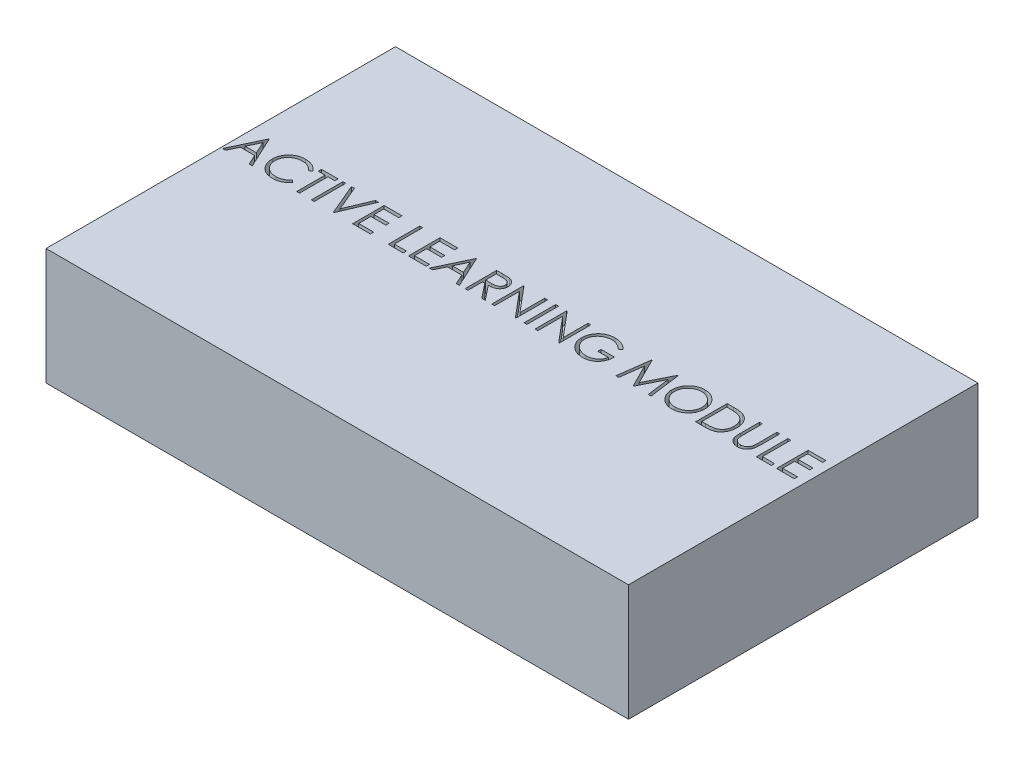
from build123d import *

# Parameters (mm, degrees)
SKETCH1_W           = 127
SKETCH1_H           = 76.2
BOSS_EXTRUDE1_DEPTH = 12.7
WRAP1_START         = -2.54
WRAP1_OUTLINE_W     = 0.617361111
WRAP1_OUTLINE_H     = 6.879166667
WRAP1_DEPTH         = 2.54


# Read off the part's stored shape, not the designer's step: Wrap1
with BuildPart() as part:
    # Sketch1 → Boss-Extrude1 (new, symmetric)
    with BuildSketch(Plane(origin=(0, 0, 0), x_dir=(1, 0, 0), z_dir=(0, 1, 0))):
        Rectangle(SKETCH1_W, SKETCH1_H)
    extrude(amount=BOSS_EXTRUDE1_DEPTH, both=True)

    # Wrap1 outline → Wrap1 (cut)
    # profile 1 of 20: a face of its own
    with BuildSketch(Plane(origin=(0, 12.7, 0), x_dir=(1, 0, 0), z_dir=(0, 1, 0)).offset(WRAP1_START)):
        with BuildLine():
            add(Edge.make_bspline(
                [(47.713194444, 2.757454427), (47.71310257, 2.699117648), (47.712928223, 2.588413556), (47.714092795, 2.43084467), (47.717354244, 2.290760348), (47.719410446, 2.167620616), (47.723984765, 2.061990526), (47.727715331, 1.973297802), (47.732512187, 1.901962411), (47.738277159, 1.860331805), (47.740755208, 1.842437066)],
                knots=[0, 0, 0, 0, 0.191078592, 0.362604556, 0.51609875, 0.650038026, 0.765976721, 0.862374026, 0.940842058, 1, 1, 1, 1], degree=3))
            Line((47.713194444, 2.757454427), (47.713194444, 6.879166667))
            Line((47.713194444, 6.879166667), (47.095833333, 6.879166667))
            Line((47.095833333, 6.879166667), (47.095833333, 2.72438151))
            add(Edge.make_bspline(
                [(47.218478733, 1.27468533), (47.208303152, 1.311307211), (47.186232089, 1.390740888), (47.162596653, 1.522204688), (47.142727494, 1.673575675), (47.124044546, 1.84486421), (47.113020272, 2.036203055), (47.103355164, 2.247509269), (47.095765244, 2.479038358), (47.095810002, 2.640314555), (47.095833333, 2.72438151)],
                knots=[0, 0, 0, 0, 0.078129865, 0.169465417, 0.274335291, 0.392110163, 0.52368733, 0.668365421, 0.827131902, 1, 1, 1, 1], degree=3))
            add(Edge.make_bspline(
                [(49.368218316, -0.176388889), (49.302042496, -0.174846451), (49.172205775, -0.171820195), (48.980890122, -0.154479289), (48.797483291, -0.121816231), (48.620048204, -0.080226865), (48.45100055, -0.022866925), (48.288075459, 0.044152128), (48.134063337, 0.126460886), (47.98646565, 0.21803909), (47.849226754, 0.321078469), (47.723244834, 0.43338612), (47.608311903, 0.553162981), (47.506365215, 0.681705843), (47.415715715, 0.818014971), (47.337626926, 0.962475977), (47.270578157, 1.11503293), (47.235972869, 1.22107666), (47.218478733, 1.27468533)],
                knots=[0, 0, 0, 0, 0.071174504, 0.139644122, 0.206317224, 0.27137324, 0.335418084, 0.398076345, 0.460607915, 0.522969511, 0.584715724, 0.64489494, 0.704290561, 0.76299819, 0.821087431, 0.880103891, 0.939388488, 1, 1, 1, 1], degree=3))
            add(Edge.make_bspline(
                [(51.505555556, 2.72438151), (51.505056088, 2.649500054), (51.504081347, 2.503364338), (51.495628666, 2.289223036), (51.482151396, 2.086085212), (51.46310969, 1.89392356), (51.437878866, 1.713425706), (51.40982126, 1.543009549), (51.37408982, 1.383898369), (51.332356076, 1.234851558), (51.284646995, 1.09297265), (51.222850167, 0.958320599), (51.153224155, 0.82680194), (51.070645356, 0.700405883), (50.977852507, 0.578572789), (50.872794501, 0.462041523), (50.758945942, 0.348949898), (50.634414236, 0.24219886), (50.501252192, 0.144301091), (50.359855918, 0.058217615), (50.211311577, -0.014551424), (50.056005296, -0.074451128), (49.893870801, -0.119489227), (49.724904003, -0.153050039), (49.548720302, -0.172119674), (49.428895722, -0.174953753), (49.368218316, -0.176388889)],
                knots=[0, 0, 0, 0, 0.054858035, 0.107058792, 0.156978355, 0.203992277, 0.248491536, 0.290483314, 0.330489004, 0.367885926, 0.403858131, 0.440009343, 0.476295011, 0.512792295, 0.550484825, 0.588381116, 0.627645327, 0.667979464, 0.708432758, 0.748602302, 0.789087777, 0.829461205, 0.870371045, 0.912214227, 0.955546575, 1, 1, 1, 1], degree=3))
            Line((51.505555556, 2.72438151), (51.505555556, 6.879166667))
            Line((51.505555556, 6.879166667), (50.888194444, 6.879166667))
            Line((50.888194444, 6.879166667), (50.888194444, 2.757454427))
            add(Edge.make_bspline(
                [(50.817914497, 1.689474826), (50.823811171, 1.713745655), (50.836951339, 1.767830843), (50.849229757, 1.859267332), (50.862018178, 1.96715107), (50.870891458, 2.092257193), (50.879541952, 2.234166485), (50.884717194, 2.393618213), (50.887109243, 2.570033382), (50.887822083, 2.693145232), (50.888194444, 2.757454427)],
                knots=[0, 0, 0, 0, 0.069835104, 0.155620755, 0.257801557, 0.373811234, 0.506402493, 0.655564458, 0.820079282, 1, 1, 1, 1], degree=3))
            add(Edge.make_bspline(
                [(49.333767361, 0.529166667), (49.389889058, 0.531277294), (49.501808308, 0.535486358), (49.668100233, 0.561551385), (49.830055684, 0.608527377), (49.988474402, 0.669142188), (50.136968063, 0.749230608), (50.275619518, 0.841747223), (50.399373632, 0.950262885), (50.512305959, 1.070354157), (50.610648434, 1.205853693), (50.69589338, 1.353811081), (50.765718749, 1.516452952), (50.800200129, 1.630754084), (50.817914497, 1.689474826)],
                knots=[0, 0, 0, 0, 0.082890648, 0.165302541, 0.247761876, 0.331527711, 0.415279813, 0.49636623, 0.577151348, 0.65778254, 0.739321642, 0.823793082, 0.909475953, 1, 1, 1, 1], degree=3))
            add(Edge.make_bspline(
                [(47.740755208, 1.842437066), (47.75093138, 1.777877535), (47.770710333, 1.652396171), (47.821117678, 1.473718107), (47.891516124, 1.312683777), (47.974936914, 1.164268132), (48.08487113, 1.03260214), (48.216564983, 0.911309355), (48.376117954, 0.805229058), (48.553523026, 0.708231213), (48.744734844, 0.630270438), (48.940125321, 0.571319194), (49.136757414, 0.535392452), (49.268397472, 0.531232445), (49.333767361, 0.529166667)],
                knots=[0, 0, 0, 0, 0.086315004, 0.167766466, 0.244432684, 0.318134662, 0.391884107, 0.47006805, 0.553904179, 0.644339498, 0.736874663, 0.826168364, 0.913678595, 1, 1, 1, 1], degree=3))
        make_face()
    # profile 2 of 20: a face of its own
    with BuildSketch(Plane(origin=(0, 12.7, 0), x_dir=(1, 0, 0), z_dir=(0, 1, 0)).offset(WRAP1_START)):
        with BuildLine():
            add(Edge.make_bspline(
                [(41.429340278, 6.879166667), (41.550156111, 6.878296806), (41.783571671, 6.876616239), (42.12087185, 6.865960624), (42.432957555, 6.847110792), (42.718802377, 6.819654021), (42.979191044, 6.785940142), (43.213394452, 6.743681609), (43.422623604, 6.693781764), (43.551302231, 6.651238147), (43.612152778, 6.631119792)],
                knots=[0, 0, 0, 0, 0.164289216, 0.317405911, 0.458843612, 0.589366542, 0.707831319, 0.815770031, 0.912879903, 1, 1, 1, 1], degree=3))
            Line((41.429340278, 6.879166667), (40.040277778, 6.879166667))
            Line((40.040277778, 6.879166667), (40.040277778, 0))
            Line((40.040277778, 0), (42.172102865, 0))
            add(Edge.make_bspline(
                [(45.684722222, 3.352766927), (45.683486002, 3.267737993), (45.6810499, 3.100179597), (45.659175494, 2.853235408), (45.627381323, 2.613617186), (45.578157548, 2.382465983), (45.518402132, 2.157756593), (45.44181902, 1.941883932), (45.354089015, 1.732867706), (45.251786218, 1.533534072), (45.139476186, 1.344684492), (45.01894976, 1.166660448), (44.890335493, 1.002002244), (44.752406958, 0.850211246), (44.606946553, 0.711516281), (44.453001946, 0.584758761), (44.290175902, 0.472418913), (44.119197708, 0.370082252), (43.935079506, 0.280809624), (43.734333893, 0.205276355), (43.516104757, 0.142682591), (43.280927753, 0.090458128), (43.028396537, 0.049031191), (42.758263522, 0.021266103), (42.470943746, 0.002490041), (42.273650691, 0.00084613), (42.172102865, 0)],
                knots=[0, 0, 0, 0, 0.046080683, 0.0908068, 0.134295271, 0.177024386, 0.218822734, 0.260244116, 0.301079867, 0.341613894, 0.381583419, 0.420119591, 0.458074619, 0.494738488, 0.531194623, 0.566933698, 0.602712651, 0.638326606, 0.674853249, 0.713467371, 0.754441804, 0.797815361, 0.843989456, 0.89307157, 0.944963346, 1, 1, 1, 1], degree=3))
            add(Edge.make_bspline(
                [(43.612152778, 6.631119792), (43.691744224, 6.600791107), (43.849122246, 6.540821492), (44.073200531, 6.427695952), (44.284145976, 6.299521153), (44.483089795, 6.156128142), (44.66548761, 5.993456786), (44.838465036, 5.818417204), (44.99494588, 5.624644169), (45.1382454, 5.416156306), (45.267447273, 5.195409641), (45.379752928, 4.962824803), (45.473022622, 4.719582957), (45.550449071, 4.466360541), (45.611470144, 4.202600755), (45.653102726, 3.927996478), (45.680562374, 3.643632976), (45.683322004, 3.450673405), (45.684722222, 3.352766927)],
                knots=[0, 0, 0, 0, 0.061544966, 0.121694296, 0.181154855, 0.239875389, 0.298701942, 0.357647424, 0.417604843, 0.478494041, 0.540407051, 0.602344994, 0.665004328, 0.728559309, 0.793650542, 0.860534268, 0.929235961, 1, 1, 1, 1], degree=3))
        make_face()
        with BuildLine():
            add(Edge.make_bspline(
                [(41.447254774, 0.705555556), (41.560718513, 0.706043183), (41.778950834, 0.706981069), (42.092754826, 0.715210917), (42.379477307, 0.728658583), (42.639158988, 0.74747817), (42.871653249, 0.772378032), (43.077445976, 0.800140192), (43.255862585, 0.834727562), (43.363825086, 0.866078793), (43.413715278, 0.880566406)],
                knots=[0, 0, 0, 0, 0.171900665, 0.330627932, 0.475548836, 0.60674619, 0.725023803, 0.829742387, 0.92132282, 1, 1, 1, 1], degree=3))
            Line((41.447254774, 0.705555556), (40.657638889, 0.705555556))
            Line((40.657638889, 0.705555556), (40.657638889, 6.173611111))
            Line((40.657638889, 6.173611111), (41.141330295, 6.173611111))
            add(Edge.make_bspline(
                [(43.255240885, 5.980685764), (43.197551906, 5.99663841), (43.074889308, 6.030558111), (42.874726266, 6.067558933), (42.649452919, 6.10019468), (42.398069101, 6.127825422), (42.120861368, 6.147651812), (41.817616522, 6.16253305), (41.48820349, 6.172570015), (41.259849485, 6.173255391), (41.141330295, 6.173611111)],
                knots=[0, 0, 0, 0, 0.084318617, 0.179284514, 0.286582528, 0.405111483, 0.535592873, 0.67819021, 0.83297584, 1, 1, 1, 1], degree=3))
            add(Edge.make_bspline(
                [(45.067361111, 3.354144965), (45.066352257, 3.434598746), (45.064370354, 3.592650911), (45.039459299, 3.824558813), (45.003055623, 4.04760233), (44.950412925, 4.261796378), (44.883329496, 4.467558842), (44.799610741, 4.663751712), (44.70395766, 4.852446996), (44.59015003, 5.02928947), (44.465508191, 5.19653795), (44.327182145, 5.34975648), (44.177369543, 5.489294087), (44.017704381, 5.617323855), (43.84368682, 5.728694961), (43.659416173, 5.828318426), (43.462189146, 5.912865136), (43.324973954, 5.957832996), (43.255240885, 5.980685764)],
                knots=[0, 0, 0, 0, 0.070151176, 0.137812606, 0.203226247, 0.267174055, 0.330024003, 0.391794272, 0.453084399, 0.514333908, 0.574999993, 0.634865483, 0.694116315, 0.753441622, 0.8131258, 0.874079686, 0.936007013, 1, 1, 1, 1], degree=3))
            add(Edge.make_bspline(
                [(43.413715278, 0.880566406), (43.476509023, 0.902681076), (43.600596685, 0.946382207), (43.779221295, 1.026097325), (43.945809169, 1.120522869), (44.103263517, 1.225483767), (44.249350788, 1.34468204), (44.385802236, 1.475525733), (44.512343133, 1.61868075), (44.627666089, 1.77396941), (44.73086991, 1.940425187), (44.820242529, 2.116411633), (44.898569765, 2.300000494), (44.960047094, 2.494010995), (45.008231891, 2.696708704), (45.042361772, 2.908107881), (45.063617856, 3.128169045), (45.066097201, 3.277844232), (45.067361111, 3.354144965)],
                knots=[0, 0, 0, 0, 0.0624145, 0.123338231, 0.183124538, 0.241782995, 0.300578883, 0.359680075, 0.418881641, 0.479530664, 0.540850536, 0.602303396, 0.664463212, 0.727805723, 0.792894815, 0.859672328, 0.928464401, 1, 1, 1, 1], degree=3))
        make_face(mode=Mode.SUBTRACT)
    # profile 3 of 20: a face of its own
    with BuildSketch(Plane(origin=(0, 12.7, 0), x_dir=(1, 0, 0), z_dir=(0, 1, 0)).offset(WRAP1_START)):
        with BuildLine():
            add(Edge.make_bspline(
                [(38.629166667, 3.44233941), (38.626120311, 3.318598048), (38.620115592, 3.074689488), (38.568681482, 2.716690885), (38.488016374, 2.37255429), (38.372846808, 2.042854204), (38.224992921, 1.727242825), (38.042881389, 1.42655061), (37.828366937, 1.140678981), (37.584241329, 0.872759683), (37.318113805, 0.62708013), (37.032667173, 0.413002673), (36.734321017, 0.228790138), (36.419236103, 0.081804607), (36.091591149, -0.035675679), (35.74845375, -0.115774003), (35.391431773, -0.167440561), (35.147966264, -0.173373382), (35.02421875, -0.176388889)],
                knots=[0, 0, 0, 0, 0.065226504, 0.128568996, 0.190320378, 0.251377989, 0.312387528, 0.373788704, 0.43643116, 0.500566755, 0.564686795, 0.627135518, 0.688455409, 0.749245746, 0.810155177, 0.871670926, 0.934773496, 1, 1, 1, 1], degree=3))
            add(Edge.make_bspline(
                [(34.969097222, 7.055555556), (35.096476011, 7.052329267), (35.346658462, 7.04599257), (35.71434972, 6.997486379), (36.065374127, 6.913569607), (36.40259115, 6.801806769), (36.721967227, 6.65271678), (37.025906288, 6.472511804), (37.313685167, 6.259303907), (37.581425049, 6.014741225), (37.826435317, 5.748648269), (38.042295482, 5.464680377), (38.223202419, 5.164554517), (38.371764484, 4.849172575), (38.488314489, 4.519247804), (38.568739895, 4.173021306), (38.620113807, 3.812736371), (38.626119865, 3.566999045), (38.629166667, 3.44233941)],
                knots=[0, 0, 0, 0, 0.066570035, 0.130749041, 0.1934128, 0.254989399, 0.316113556, 0.377261758, 0.439400784, 0.502970589, 0.566524976, 0.628231103, 0.689090611, 0.749344669, 0.810169593, 0.871609824, 0.934869184, 1, 1, 1, 1], degree=3))
            add(Edge.make_bspline(
                [(31.397222222, 3.409266493), (31.398273036, 3.491094513), (31.400361406, 3.653718256), (31.425503173, 3.895209633), (31.461985755, 4.132817342), (31.51427118, 4.365865718), (31.582653373, 4.593784272), (31.663340156, 4.818144878), (31.761888828, 5.03667384), (31.873293292, 5.250406388), (31.99763287, 5.456010736), (32.134971992, 5.650356202), (32.280486745, 5.835073614), (32.440011463, 6.005376237), (32.608288548, 6.16621834), (32.788047812, 6.315128156), (32.97819239, 6.453448447), (33.179540449, 6.578099617), (33.387130653, 6.690837631), (33.601125368, 6.787582007), (33.818618224, 6.870615635), (34.040627895, 6.937915162), (34.266564832, 6.991045985), (34.496922149, 7.0272252), (34.731516328, 7.052431092), (34.889562861, 7.054509587), (34.969097222, 7.055555556)],
                knots=[0, 0, 0, 0, 0.043208986, 0.085872872, 0.128120007, 0.170151964, 0.211917621, 0.253753003, 0.296006409, 0.338443357, 0.381015368, 0.422820479, 0.464089056, 0.505125849, 0.545974971, 0.586985211, 0.628338592, 0.670083802, 0.711991602, 0.753039155, 0.794049395, 0.834885543, 0.875498313, 0.9165473, 0.958003779, 1, 1, 1, 1], degree=3))
            add(Edge.make_bspline(
                [(35.02421875, -0.176388889), (34.899559761, -0.173343606), (34.653823711, -0.167340543), (34.293086037, -0.115881615), (33.946616329, -0.035412457), (33.615405384, 0.079586447), (33.299268504, 0.228210313), (32.997587401, 0.409435825), (32.711572982, 0.624472956), (32.443596526, 0.868519402), (32.198404947, 1.134195869), (31.984640984, 1.418864149), (31.803374719, 1.716939338), (31.655249884, 2.029248639), (31.537980809, 2.354282272), (31.457976458, 2.694208387), (31.406213772, 3.047089011), (31.400248853, 3.287354517), (31.397222222, 3.409266493)],
                knots=[0, 0, 0, 0, 0.065818877, 0.129746527, 0.192071954, 0.253459424, 0.314569588, 0.376279881, 0.439025654, 0.503267029, 0.567492823, 0.629704796, 0.690999649, 0.751451651, 0.812004364, 0.873149681, 0.935635484, 1, 1, 1, 1], degree=3))
        make_face()
        with BuildLine():
            add(Edge.make_bspline(
                [(32.014583333, 3.412022569), (32.017089044, 3.312643728), (32.022018553, 3.117134804), (32.065175634, 2.830630988), (32.131651919, 2.555290796), (32.229645386, 2.292620806), (32.352194035, 2.040363174), (32.503588553, 1.800755696), (32.682956113, 1.573733616), (32.886704307, 1.360881843), (33.109437388, 1.166602768), (33.345948504, 0.996071355), (33.593703868, 0.851785256), (33.853349568, 0.734239811), (34.123499433, 0.641096409), (34.405894239, 0.577260433), (34.698652821, 0.535247485), (34.898208906, 0.531212842), (34.999414063, 0.529166667)],
                knots=[0, 0, 0, 0, 0.064503999, 0.126899322, 0.18774654, 0.248149733, 0.308586065, 0.369583005, 0.431826965, 0.496179723, 0.560667855, 0.623504455, 0.685260411, 0.746536822, 0.808327352, 0.870486188, 0.934316883, 1, 1, 1, 1], degree=3))
            add(Edge.make_bspline(
                [(34.999414063, 6.35), (34.934131491, 6.349204198), (34.804190454, 6.347620201), (34.611014538, 6.326755265), (34.420379202, 6.297017829), (34.232245074, 6.254599864), (34.047399332, 6.196806898), (33.864118989, 6.130293399), (33.684075368, 6.049274326), (33.507862845, 5.957736785), (33.337033334, 5.856418608), (33.175839322, 5.744441957), (33.023863506, 5.624432822), (32.88147799, 5.496111132), (32.749100865, 5.358823403), (32.624126648, 5.214650936), (32.511564649, 5.059472874), (32.408405498, 4.897497182), (32.316091326, 4.728934836), (32.234002516, 4.555560452), (32.16685397, 4.375959784), (32.112091132, 4.192081315), (32.066689004, 4.004216266), (32.037926375, 3.810939497), (32.016832178, 3.613222199), (32.01533872, 3.479605484), (32.014583333, 3.412022569)],
                knots=[0, 0, 0, 0, 0.042023329, 0.083644911, 0.124983795, 0.166247461, 0.207701556, 0.249631071, 0.29174177, 0.334742875, 0.377460169, 0.419556319, 0.461044176, 0.502096284, 0.542890714, 0.583800819, 0.624863583, 0.666224689, 0.707399186, 0.748556678, 0.789654591, 0.830739726, 0.872070142, 0.913993395, 0.95649813, 1, 1, 1, 1], degree=3))
            add(Edge.make_bspline(
                [(38.011805556, 3.443717448), (38.011017178, 3.510377564), (38.009453285, 3.642610184), (37.988732302, 3.838098054), (37.959051861, 4.029246926), (37.916277777, 4.215306376), (37.861145867, 4.396323835), (37.793165293, 4.572129288), (37.713002758, 4.743377681), (37.621002307, 4.909645757), (37.517587159, 5.069192772), (37.404583593, 5.221718466), (37.28004051, 5.364358461), (37.147516263, 5.500634152), (37.00370063, 5.627639075), (36.849245071, 5.745415363), (36.6860247, 5.856805334), (36.513205812, 5.957291408), (36.334850732, 6.050089859), (36.151837464, 6.129595342), (35.966239317, 6.197152925), (35.778528258, 6.254774721), (35.587124333, 6.296851695), (35.393320855, 6.326782064), (35.197385957, 6.347612939), (35.065614105, 6.349201788), (34.999414063, 6.35)],
                knots=[0, 0, 0, 0, 0.042915082, 0.085129971, 0.126473319, 0.167453038, 0.207976333, 0.248249378, 0.288749987, 0.329669857, 0.370537287, 0.411128564, 0.451818913, 0.492405877, 0.533485862, 0.575263062, 0.617440613, 0.660671688, 0.703940204, 0.746867522, 0.7890793, 0.831104042, 0.87323799, 0.91516577, 0.957380658, 1, 1, 1, 1], degree=3))
            add(Edge.make_bspline(
                [(34.999414063, 0.529166667), (35.067438214, 0.530101259), (35.202350537, 0.531954837), (35.403016855, 0.55062426), (35.600068052, 0.580562137), (35.79322774, 0.623666318), (35.982276697, 0.677613149), (36.168003983, 0.741702862), (36.348431336, 0.821660799), (36.525834899, 0.910004928), (36.695644655, 1.010716237), (36.85774835, 1.11889241), (37.008060067, 1.238724782), (37.150339064, 1.365139912), (37.283259676, 1.500686713), (37.405923049, 1.645188958), (37.517916142, 1.79955875), (37.621036121, 1.961288756), (37.713026819, 2.130312343), (37.793177168, 2.304315317), (37.86117501, 2.482869216), (37.916067821, 2.666231579), (37.959083175, 2.854054152), (37.988722398, 3.046588422), (38.009455103, 3.243449225), (38.011017809, 3.376598161), (38.011805556, 3.443717448)],
                knots=[0, 0, 0, 0, 0.043633218, 0.086537777, 0.129177336, 0.171436324, 0.213415895, 0.255265955, 0.297369481, 0.339940748, 0.382347459, 0.423952947, 0.464871163, 0.505572294, 0.546002577, 0.586567975, 0.627064799, 0.668270684, 0.709549225, 0.750428154, 0.791096194, 0.832027145, 0.873135955, 0.914610764, 0.956955986, 1, 1, 1, 1], degree=3))
        make_face(mode=Mode.SUBTRACT)
    # profile 4 of 20: a face of its own
    with BuildSketch(Plane(origin=(0, 12.7, 0), x_dir=(1, 0, 0), z_dir=(0, 1, 0)).offset(WRAP1_START)):
        with BuildLine():
            add(Edge.make_bspline(
                [(17.991666667, 5.203472222), (17.895910852, 5.293551692), (17.706682575, 5.471562636), (17.398180955, 5.702527699), (17.076307432, 5.900384522), (16.74274156, 6.06136928), (16.405743854, 6.189818574), (16.069787414, 6.281268526), (15.738318304, 6.339589192), (15.517856307, 6.346563428), (15.40922309, 6.35)],
                knots=[0, 0, 0, 0, 0.136144491, 0.269042539, 0.398516618, 0.527099539, 0.652282545, 0.771680405, 0.887494932, 1, 1, 1, 1], degree=3))
            Line((17.991666667, 5.203472222), (18.520833333, 5.705078125))
            add(Edge.make_bspline(
                [(15.429893663, 7.055555556), (15.501119068, 7.054416578), (15.642350677, 7.05215812), (15.852510658, 7.036503794), (16.059422262, 7.011691856), (16.263392285, 6.977833018), (16.463726131, 6.931715693), (16.660994501, 6.876528493), (16.855483355, 6.812273494), (17.046583164, 6.735641844), (17.235578865, 6.648662398), (17.423521316, 6.550755303), (17.609768357, 6.440246395), (17.794642977, 6.316807541), (17.979310979, 6.182558799), (18.160851484, 6.033660566), (18.343646557, 5.87598465), (18.461185599, 5.762611691), (18.520833333, 5.705078125)],
                knots=[0, 0, 0, 0, 0.061616945, 0.122179161, 0.18221627, 0.241864129, 0.300960056, 0.359969068, 0.419032918, 0.478068687, 0.537992581, 0.59896023, 0.661321079, 0.725247569, 0.791220154, 0.858745972, 0.928317581, 1, 1, 1, 1], degree=3))
            add(Edge.make_bspline(
                [(11.729861111, 3.44233941), (11.730907212, 3.523250699), (11.73298612, 3.684044945), (11.758194367, 3.922766391), (11.794361916, 4.157249061), (11.847522257, 4.387301281), (11.914537654, 4.613076694), (11.998175517, 4.834680132), (12.095554831, 5.05224237), (12.208737752, 5.264265889), (12.334694232, 5.467937206), (12.471393534, 5.662436412), (12.6207768, 5.844221467), (12.780404521, 6.015594576), (12.952181224, 6.174402786), (13.134497663, 6.322116401), (13.32749434, 6.458933564), (13.531778427, 6.582699275), (13.744300817, 6.693873724), (13.964552081, 6.791340139), (14.192464987, 6.87189187), (14.426332042, 6.940238905), (14.667923463, 6.990781402), (14.915486071, 7.027435067), (15.17031028, 7.052515722), (15.342556809, 7.054532803), (15.429893663, 7.055555556)],
                knots=[0, 0, 0, 0, 0.04203938, 0.083544465, 0.124643057, 0.165303063, 0.206170747, 0.24697072, 0.288329266, 0.329986533, 0.371797473, 0.412737629, 0.453459281, 0.494001342, 0.534380668, 0.574951545, 0.615891702, 0.657249559, 0.699006607, 0.740486274, 0.782325156, 0.824567455, 0.867041244, 0.910499531, 0.954619176, 1, 1, 1, 1], degree=3))
            add(Edge.make_bspline(
                [(12.573220486, 1.124479167), (12.506028851, 1.208347319), (12.372760892, 1.374691499), (12.201217753, 1.641209962), (12.054983568, 1.917166475), (11.936332051, 2.20332925), (11.843683264, 2.499430622), (11.777237879, 2.805092224), (11.738307124, 3.120707665), (11.732698564, 3.334286655), (11.729861111, 3.44233941)],
                knots=[0, 0, 0, 0, 0.127895677, 0.253668418, 0.376738432, 0.499344473, 0.621999307, 0.745698548, 0.871345153, 1, 1, 1, 1], degree=3))
            add(Edge.make_bspline(
                [(15.553917101, -0.176388889), (15.47626087, -0.175270295), (15.323097756, -0.173064066), (15.096889277, -0.15738478), (14.876917859, -0.1332476), (14.663215546, -0.096797601), (14.454996257, -0.052152489), (14.253299906, 0.005016764), (14.05735816, 0.071191791), (13.866868167, 0.146461026), (13.683558921, 0.23367246), (13.506613945, 0.330589383), (13.335055144, 0.436712048), (13.170051128, 0.553875746), (13.010742164, 0.681204129), (12.858155479, 0.818952403), (12.711436852, 0.966699449), (12.619530275, 1.071614621), (12.573220486, 1.124479167)],
                knots=[0, 0, 0, 0, 0.069236524, 0.136556739, 0.202094157, 0.26646426, 0.329768823, 0.391878966, 0.453270593, 0.514114664, 0.57438951, 0.634141664, 0.693923287, 0.754152196, 0.814470164, 0.87566063, 0.937348011, 1, 1, 1, 1], degree=3))
            add(Edge.make_bspline(
                [(18.961805556, 3.351388889), (18.958452751, 3.219883813), (18.951890707, 2.962504623), (18.905861386, 2.587157103), (18.831533932, 2.232640834), (18.729996819, 1.898582464), (18.598555048, 1.58545539), (18.43861928, 1.292941694), (18.24762979, 1.022931099), (18.032389625, 0.773219307), (17.790832684, 0.550473439), (17.529486027, 0.354700339), (17.247917867, 0.189791747), (16.946394543, 0.05562704), (16.625903143, -0.049081729), (16.285702054, -0.123320863), (15.926252622, -0.167799518), (15.679906368, -0.173482455), (15.553917101, -0.176388889)],
                knots=[0, 0, 0, 0, 0.071272278, 0.139492722, 0.204635419, 0.26740574, 0.328445598, 0.388397163, 0.447733931, 0.507391621, 0.566767555, 0.625478338, 0.684066506, 0.743248446, 0.804033357, 0.866498751, 0.931723238, 1, 1, 1, 1], degree=3))
            Line((18.961805556, 3.351388889), (16.051388889, 3.351388889))
            Line((16.051388889, 3.351388889), (16.051388889, 2.645833333))
            Line((16.051388889, 2.645833333), (18.344444444, 2.645833333))
            add(Edge.make_bspline(
                [(15.60766059, 0.529166667), (15.696850651, 0.531031071), (15.871989827, 0.534692131), (16.129440561, 0.563192105), (16.376703501, 0.607703839), (16.61308386, 0.672890619), (16.838856185, 0.756037485), (17.054848145, 0.856267703), (17.259359203, 0.977425668), (17.453004155, 1.114171447), (17.631385242, 1.266525005), (17.792267574, 1.43092619), (17.933085077, 1.606576997), (18.055936575, 1.792442873), (18.157568704, 1.990062276), (18.240989007, 2.198466752), (18.304932417, 2.417750041), (18.331181303, 2.569271807), (18.344444444, 2.645833333)],
                knots=[0, 0, 0, 0, 0.070630068, 0.138693613, 0.204917715, 0.269440883, 0.332636335, 0.395301694, 0.457763931, 0.52065702, 0.582851652, 0.643315198, 0.702580232, 0.760907539, 0.819489613, 0.878269076, 0.938491311, 1, 1, 1, 1], degree=3))
            add(Edge.make_bspline(
                [(12.347222222, 3.469900174), (12.348707568, 3.406472651), (12.351674205, 3.279790804), (12.370661333, 3.090723645), (12.405898863, 2.904464503), (12.453006824, 2.720401327), (12.511933403, 2.538218886), (12.585388489, 2.358707013), (12.672391473, 2.181872351), (12.773095696, 2.009308225), (12.883528341, 1.841214759), (13.007241468, 1.682876937), (13.138654353, 1.532186281), (13.28255453, 1.39248856), (13.434327701, 1.260047116), (13.598508401, 1.13851087), (13.771868237, 1.02553879), (13.954671697, 0.922554679), (14.144935262, 0.830553617), (14.340022046, 0.74874284), (14.540555289, 0.681367619), (14.745481123, 0.62645594), (14.954555256, 0.581445951), (15.168838944, 0.552489612), (15.386756613, 0.531477038), (15.533653614, 0.529940685), (15.60766059, 0.529166667)],
                knots=[0, 0, 0, 0, 0.038994203, 0.077881926, 0.116651567, 0.155416065, 0.194618293, 0.234261464, 0.274547108, 0.315667309, 0.357019556, 0.398082512, 0.439097864, 0.479833278, 0.521274132, 0.562840828, 0.605292061, 0.64840866, 0.691727292, 0.735148885, 0.778368925, 0.821660858, 0.865523699, 0.909731498, 0.954522565, 1, 1, 1, 1], degree=3))
            add(Edge.make_bspline(
                [(15.40922309, 6.35), (15.342564555, 6.349187067), (15.209420366, 6.347563311), (15.011650331, 6.326838907), (14.815954477, 6.297032728), (14.622702225, 6.253906489), (14.431517827, 6.199248445), (14.243066217, 6.130878445), (14.056995854, 6.051168078), (13.875059425, 5.959061002), (13.698676602, 5.857878589), (13.53208906, 5.745751041), (13.374234987, 5.626272122), (13.228081341, 5.496450495), (13.092787421, 5.35746211), (12.965132942, 5.211892446), (12.849607566, 5.055764415), (12.745258146, 4.891950571), (12.652170013, 4.723328066), (12.5699961, 4.551519916), (12.501013608, 4.377095983), (12.446433405, 4.199837395), (12.40140306, 4.021115485), (12.369724287, 3.839692755), (12.351864551, 3.655374947), (12.348775255, 3.531948431), (12.347222222, 3.469900174)],
                knots=[0, 0, 0, 0, 0.042841197, 0.085571284, 0.127718668, 0.170068387, 0.212787245, 0.255481593, 0.298877091, 0.342860572, 0.386527586, 0.429532376, 0.471886213, 0.513729302, 0.555081706, 0.596535237, 0.638120075, 0.679822212, 0.721331468, 0.761888364, 0.802199329, 0.841806293, 0.881060412, 0.920633226, 0.960101199, 1, 1, 1, 1], degree=3))
        make_face()
    # profile 5 of 20: a face of its own
    with BuildSketch(Plane(origin=(0, 12.7, 0), x_dir=(1, 0, 0), z_dir=(0, 1, 0)).offset(WRAP1_START)):
        with BuildLine():
            add(Edge.make_bspline(
                [(-8.853895399, 6.879166667), (-8.762026824, 6.878860866), (-8.585628983, 6.878273695), (-8.332921281, 6.874999678), (-8.103300404, 6.865615795), (-7.89688641, 6.857540472), (-7.713683087, 6.84281524), (-7.553128662, 6.828741159), (-7.415962604, 6.810317452), (-7.332929389, 6.79320715), (-7.295334201, 6.785460069)],
                knots=[0, 0, 0, 0, 0.176257755, 0.338434414, 0.484822051, 0.617157578, 0.734698361, 0.837385184, 0.926372421, 1, 1, 1, 1], degree=3))
            Line((-8.853895399, 6.879166667), (-10.230555556, 6.879166667))
            Line((-10.230555556, 6.879166667), (-10.230555556, 0))
            Line((-10.230555556, 0), (-9.613194444, 0))
            Line((-9.613194444, 0), (-9.613194444, 3.175))
            Line((-9.613194444, 3.175), (-9.111588542, 3.175))
            Line((-9.111588542, 3.175), (-6.584266493, 0))
            Line((-6.584266493, 0), (-5.820833333, 0))
            Line((-5.820833333, 0), (-8.348155382, 3.175))
            add(Edge.make_bspline(
                [(-5.909027778, 5.039485677), (-5.911915059, 4.947825489), (-5.917548891, 4.768972722), (-5.970076446, 4.509410204), (-6.056118153, 4.267284539), (-6.174682142, 4.042900593), (-6.325668992, 3.84063217), (-6.507131171, 3.662971882), (-6.71916991, 3.514303435), (-6.916561339, 3.411208696), (-7.090926986, 3.345182634), (-7.234472224, 3.298725933), (-7.391055771, 3.262832475), (-7.559177366, 3.230677026), (-7.739536646, 3.206400065), (-7.93170133, 3.188619199), (-8.135808469, 3.1775063), (-8.276023711, 3.17585136), (-8.348155382, 3.175)],
                knots=[0, 0, 0, 0, 0.078780236, 0.153720644, 0.22671353, 0.299191166, 0.371189997, 0.443006414, 0.516689173, 0.593217217, 0.633872918, 0.676989142, 0.722899506, 0.771958611, 0.824211323, 0.879378651, 0.937948119, 1, 1, 1, 1], degree=3))
            add(Edge.make_bspline(
                [(-7.295334201, 6.785460069), (-7.245004991, 6.773024963), (-7.14542023, 6.748420024), (-7.002038612, 6.696414309), (-6.865409863, 6.636232165), (-6.73610153, 6.565546329), (-6.614761302, 6.48383209), (-6.500138051, 6.392500102), (-6.391711646, 6.292050105), (-6.293867037, 6.179949482), (-6.201609449, 6.062342247), (-6.123798946, 5.935168554), (-6.056724163, 5.802181432), (-6.003321158, 5.662028401), (-5.960320523, 5.516068656), (-5.930000616, 5.362980081), (-5.911817627, 5.203460117), (-5.909966433, 5.094655465), (-5.909027778, 5.039485677)],
                knots=[0, 0, 0, 0, 0.064216843, 0.127063766, 0.188744538, 0.249132103, 0.309452533, 0.369826676, 0.430650142, 0.492351932, 0.554072106, 0.615689784, 0.676797703, 0.738439048, 0.80131691, 0.865184512, 0.931641324, 1, 1, 1, 1], degree=3))
        make_face()
        with BuildLine():
            add(Edge.make_bspline(
                [(-8.353667535, 3.870909288), (-8.294860411, 3.870883272), (-8.180875455, 3.870832845), (-8.015970696, 3.878682517), (-7.862427476, 3.887612301), (-7.720833093, 3.901271074), (-7.591124292, 3.91887402), (-7.473365905, 3.940893218), (-7.367365707, 3.966546737), (-7.243740127, 4.006252551), (-7.105691897, 4.069159618), (-6.95566423, 4.160682997), (-6.827903683, 4.275799206), (-6.719963932, 4.40743394), (-6.633228585, 4.552164234), (-6.572078583, 4.708255216), (-6.533275283, 4.871766321), (-6.528698582, 4.984148531), (-6.526388889, 5.040863715)],
                knots=[0, 0, 0, 0, 0.07166815, 0.138913286, 0.20118457, 0.259124428, 0.312255041, 0.36068151, 0.405086143, 0.445101659, 0.51877778, 0.589461579, 0.658462242, 0.727283218, 0.796322487, 0.863174893, 0.930949381, 1, 1, 1, 1], degree=3))
            Line((-8.353667535, 3.870909288), (-9.613194444, 3.880555556))
            Line((-9.613194444, 3.880555556), (-9.613194444, 6.173611111))
            Line((-9.613194444, 6.173611111), (-8.323350694, 6.173611111))
            add(Edge.make_bspline(
                [(-6.526388889, 5.040863715), (-6.528751629, 5.096185136), (-6.533433719, 5.205812005), (-6.57165981, 5.366304752), (-6.636303106, 5.517778008), (-6.723417409, 5.659615585), (-6.829551463, 5.788365549), (-6.954001116, 5.898524894), (-7.093363589, 5.989427116), (-7.223618051, 6.047515547), (-7.340041486, 6.083129687), (-7.441125258, 6.108191796), (-7.555341984, 6.128327056), (-7.683246248, 6.144459804), (-7.824292025, 6.158326129), (-7.979192483, 6.167665637), (-8.146919893, 6.17319622), (-8.263171778, 6.173469595), (-8.323350694, 6.173611111)],
                knots=[0, 0, 0, 0, 0.068814296, 0.136364825, 0.204019354, 0.273063739, 0.34291332, 0.410965444, 0.479168767, 0.549308007, 0.587651576, 0.630646669, 0.678878786, 0.731934299, 0.791111423, 0.85528319, 0.925085939, 1, 1, 1, 1], degree=3))
        make_face(mode=Mode.SUBTRACT)
    # profile 6 of 20: a face of its own
    with BuildSketch(Plane(origin=(0, 12.7, 0), x_dir=(1, 0, 0), z_dir=(0, 1, 0)).offset(WRAP1_START)):
        with BuildLine():
            add(Edge.make_bspline(
                [(-49.576302083, 5.203472222), (-49.61483699, 5.24939748), (-49.69138727, 5.340628822), (-49.81454244, 5.468737665), (-49.942891264, 5.588759982), (-50.07638468, 5.701267534), (-50.217425521, 5.802325963), (-50.362597162, 5.897201666), (-50.514328082, 5.982243375), (-50.724146075, 6.085358125), (-50.998620595, 6.192960389), (-51.344141166, 6.283182098), (-51.704827861, 6.340615623), (-51.950900762, 6.346836043), (-52.076063368, 6.35)],
                knots=[0, 0, 0, 0, 0.063163259, 0.125474941, 0.18712122, 0.248294346, 0.309294856, 0.369850066, 0.430973376, 0.49245599, 0.616147966, 0.740843698, 0.868182649, 1, 1, 1, 1], degree=3))
            Line((-49.576302083, 5.203472222), (-49.036111111, 5.616883681))
            add(Edge.make_bspline(
                [(-52.037478299, 7.055555556), (-51.958437711, 7.054607924), (-51.801984829, 7.052732184), (-51.570544795, 7.034441183), (-51.345218031, 7.00394956), (-51.125849303, 6.962446427), (-50.911371399, 6.910936561), (-50.703423544, 6.843834617), (-50.50078553, 6.767109244), (-50.304735357, 6.67874445), (-50.116213661, 6.579553271), (-49.935279159, 6.470635183), (-49.763369062, 6.352125213), (-49.599273718, 6.225031281), (-49.445738165, 6.086664589), (-49.298403164, 5.940830981), (-49.162272164, 5.783329857), (-49.078241777, 5.672467303), (-49.036111111, 5.616883681)],
                knots=[0, 0, 0, 0, 0.068547537, 0.135682946, 0.20121499, 0.265682235, 0.329266835, 0.392395428, 0.455069762, 0.51712685, 0.578790035, 0.639739863, 0.700191504, 0.759806243, 0.819628319, 0.879354791, 0.939511608, 1, 1, 1, 1], degree=3))
            add(Edge.make_bspline(
                [(-55.738888889, 3.479546441), (-55.735832193, 3.603283886), (-55.729818335, 3.846729584), (-55.678724218, 4.204001961), (-55.596530369, 4.546292389), (-55.479787199, 4.872961892), (-55.331776324, 5.185728669), (-55.148934729, 5.482203466), (-54.933386573, 5.764282318), (-54.686822365, 6.027685121), (-54.416437043, 6.268533301), (-54.126885422, 6.480423828), (-53.818734238, 6.656761469), (-53.495378318, 6.804164641), (-53.154396341, 6.917463461), (-52.796515814, 6.996776689), (-52.422409209, 7.046143783), (-52.167167704, 7.052384578), (-52.037478299, 7.055555556)],
                knots=[0, 0, 0, 0, 0.064557846, 0.127013532, 0.18795481, 0.248013913, 0.307747682, 0.368234515, 0.429469844, 0.492743437, 0.556257769, 0.618216786, 0.679655476, 0.741245546, 0.803415265, 0.866815462, 0.932328312, 1, 1, 1, 1], degree=3))
            add(Edge.make_bspline(
                [(-54.866590712, 1.026638455), (-54.936238625, 1.112217625), (-55.074693602, 1.282342778), (-55.251833487, 1.558071534), (-55.40346517, 1.845951312), (-55.526063557, 2.147494529), (-55.621905548, 2.462024548), (-55.688301683, 2.789699922), (-55.731447039, 3.130214628), (-55.736380952, 3.36182003), (-55.738888889, 3.479546441)],
                knots=[0, 0, 0, 0, 0.12432851, 0.247156016, 0.368779749, 0.490733862, 0.613613772, 0.738957576, 0.867310575, 1, 1, 1, 1], degree=3))
            add(Edge.make_bspline(
                [(-52.029210069, -0.176388889), (-52.103197801, -0.175873949), (-52.249499377, -0.174855718), (-52.465502757, -0.158361113), (-52.675788231, -0.135856928), (-52.879754787, -0.101971861), (-53.078515483, -0.061985545), (-53.270268489, -0.008384539), (-53.456900694, 0.05165912), (-53.637662278, 0.122229517), (-53.812706998, 0.201863109), (-53.981470275, 0.291865328), (-54.143874491, 0.391479326), (-54.301516336, 0.498509353), (-54.452067063, 0.616393311), (-54.596831314, 0.743494042), (-54.736620847, 0.879383156), (-54.823107077, 0.977371683), (-54.866590712, 1.026638455)],
                knots=[0, 0, 0, 0, 0.069662801, 0.137749562, 0.203916744, 0.268779862, 0.332413706, 0.39475354, 0.456180032, 0.516995649, 0.577395938, 0.637198344, 0.696999184, 0.756756194, 0.816553905, 0.876947997, 0.938131788, 1, 1, 1, 1], degree=3))
            add(Edge.make_bspline(
                [(-49.036111111, 1.266417101), (-49.079583729, 1.210325453), (-49.166320735, 1.098410833), (-49.306769766, 0.940638699), (-49.454725501, 0.792237315), (-49.611286903, 0.654403145), (-49.774652943, 0.524378118), (-49.947756976, 0.405856304), (-50.128323372, 0.297183388), (-50.31574033, 0.197677373), (-50.509808723, 0.109393594), (-50.710296011, 0.033813629), (-50.916338011, -0.031292553), (-51.127944143, -0.084855586), (-51.345553327, -0.126663395), (-51.568380294, -0.154611827), (-51.796905965, -0.173759328), (-51.951080711, -0.175504505), (-52.029210069, -0.176388889)],
                knots=[0, 0, 0, 0, 0.061674239, 0.123053062, 0.183475001, 0.243726501, 0.304278917, 0.364862921, 0.425946204, 0.48739123, 0.549220384, 0.611143589, 0.67352853, 0.736961457, 0.800785283, 0.866012596, 0.932100748, 1, 1, 1, 1], degree=3))
            Line((-49.036111111, 1.266417101), (-49.576302083, 1.675694444))
            add(Edge.make_bspline(
                [(-52.033344184, 0.529166667), (-51.913248304, 0.532485923), (-51.676870882, 0.539019014), (-51.330223725, 0.594365347), (-50.998381048, 0.684104898), (-50.681325, 0.809694743), (-50.379949403, 0.972957588), (-50.093782634, 1.170876869), (-49.822583143, 1.405335247), (-49.659505063, 1.584356967), (-49.576302083, 1.675694444)],
                knots=[0, 0, 0, 0, 0.12851519, 0.252948636, 0.374754734, 0.495939754, 0.617180641, 0.740909469, 0.867811148, 1, 1, 1, 1], degree=3))
            add(Edge.make_bspline(
                [(-55.121527778, 3.432693142), (-55.119047703, 3.331016465), (-55.114178404, 3.131387795), (-55.070842928, 2.838982702), (-55.004989469, 2.558861711), (-54.906291948, 2.292775854), (-54.784591528, 2.03744407), (-54.630811469, 1.797186514), (-54.452706823, 1.568372528), (-54.247757934, 1.356409782), (-54.022896027, 1.1627834), (-53.781637929, 0.992277198), (-53.524584525, 0.850144018), (-53.254574029, 0.731869628), (-52.969528656, 0.640953131), (-52.66996099, 0.576949122), (-52.356522581, 0.535198122), (-52.14234582, 0.531200956), (-52.033344184, 0.529166667)],
                knots=[0, 0, 0, 0, 0.064323217, 0.126290104, 0.186726469, 0.246146432, 0.305575643, 0.365429386, 0.426326309, 0.488839906, 0.551724972, 0.613918596, 0.675483766, 0.737333897, 0.800229044, 0.864502298, 0.931040739, 1, 1, 1, 1], degree=3))
            add(Edge.make_bspline(
                [(-52.076063368, 6.35), (-52.145018758, 6.349206021), (-52.282289566, 6.347625433), (-52.486008172, 6.32677345), (-52.685922753, 6.297465821), (-52.881903265, 6.253979025), (-53.073700247, 6.198999509), (-53.262567575, 6.133302653), (-53.44577079, 6.0520207), (-53.625844256, 5.962182204), (-53.798372205, 5.86070969), (-53.961614924, 5.750027138), (-54.114977037, 5.631373116), (-54.258579862, 5.504302906), (-54.392570203, 5.369388767), (-54.515977167, 5.2251929), (-54.62837373, 5.072176307), (-54.731987787, 4.91235674), (-54.824783291, 4.746199724), (-54.902478327, 4.57309027), (-54.971280062, 4.395992801), (-55.025722264, 4.212906412), (-55.068814379, 4.025119381), (-55.098547441, 3.832127725), (-55.119162282, 3.634334623), (-55.12073501, 3.500270844), (-55.121527778, 3.432693142)],
                knots=[0, 0, 0, 0, 0.043954909, 0.087501875, 0.130462627, 0.172752021, 0.215403067, 0.25764983, 0.300152749, 0.34312149, 0.385925163, 0.427685727, 0.46881795, 0.5094918, 0.549883031, 0.589980023, 0.63040523, 0.670868626, 0.711383944, 0.751627258, 0.791775577, 0.832458919, 0.873319045, 0.914542956, 0.956923558, 1, 1, 1, 1], degree=3))
        make_face()
    # profile 7 of 20: a face of its own
    with BuildSketch(Plane(origin=(0, 12.7, 0), x_dir=(1, 0, 0), z_dir=(0, 1, 0)).offset(WRAP1_START)):
        Polygon((-57.291937934, 0), (-56.620833333, 0), (-59.795833333, 6.879166667), (-59.884027778, 6.879166667), (-63.147222222, 0), (-62.473361545, 0), (-61.427430556, 2.204861111), (-58.308930122, 2.204861111), align=None)
        Polygon((-58.634147135, 2.910416667), (-61.092567274, 2.910416667), (-59.846820747, 5.538335503), align=None, mode=Mode.SUBTRACT)
    # profile 8 of 20: a face of its own
    with BuildSketch(Plane(origin=(0, 12.7, 0), x_dir=(1, 0, 0), z_dir=(0, 1, 0)).offset(WRAP1_START)):
        Polygon((57.679166667, 0), (61.559722222, 0), (61.559722222, 0.705555556), (58.296527778, 0.705555556), (58.296527778, 3.351388889), (61.559722222, 3.351388889), (61.559722222, 4.056944444), (58.296527778, 4.056944444), (58.296527778, 6.173611111), (61.559722222, 6.173611111), (61.559722222, 6.879166667), (57.679166667, 6.879166667), align=None)
    # profile 9 of 20: a face of its own
    with BuildSketch(Plane(origin=(0, 12.7, 0), x_dir=(1, 0, 0), z_dir=(0, 1, 0)).offset(WRAP1_START)):
        Polygon((53.269444444, 0), (56.532638889, 0), (56.532638889, 0.705555556), (53.886805556, 0.705555556), (53.886805556, 6.879166667), (53.269444444, 6.879166667), align=None)
    # profile 10 of 20: a face of its own
    with BuildSketch(Plane(origin=(0, 12.7, 0), x_dir=(1, 0, 0), z_dir=(0, 1, 0)).offset(WRAP1_START)):
        Polygon((29.718771701, 0), (30.338888889, 0), (29.425249566, 6.879166667), (29.335677083, 6.879166667), (26.502430556, 1.234722222), (23.662293837, 6.879166667), (23.574099392, 6.879166667), (22.665972222, 0), (23.287467448, 0), (23.944791667, 4.9609375), (26.43766276, 0), (26.576844618, 0), (29.060069444, 4.949913194), align=None)
    # profile 11 of 20: a face of its own
    with BuildSketch(Plane(origin=(0, 12.7, 0), x_dir=(1, 0, 0), z_dir=(0, 1, 0)).offset(WRAP1_START)):
        Polygon((10.178190104, 0), (10.31875, 0), (10.31875, 6.879166667), (9.701388889, 6.879166667), (9.701388889, 1.464854601), (5.156618924, 6.879166667), (5.027083333, 6.879166667), (5.027083333, 0), (5.644444444, 0), (5.644444444, 5.401909722), align=None)
    # profile 12 of 20: a face of its own
    with BuildSketch(Plane(origin=(0, 12.7, 0), x_dir=(1, 0, 0), z_dir=(0, 1, 0)).offset(WRAP1_START)):
        with Locations((2.954513889, 3.439583334)):
            Rectangle(WRAP1_OUTLINE_W, WRAP1_OUTLINE_H)
    # profile 13 of 20: a face of its own
    with BuildSketch(Plane(origin=(0, 12.7, 0), x_dir=(1, 0, 0), z_dir=(0, 1, 0)).offset(WRAP1_START)):
        Polygon((0.741384549, 0), (0.881944444, 0), (0.881944444, 6.879166667), (0.264583333, 6.879166667), (0.264583333, 1.464854601), (-4.280186632, 6.879166667), (-4.409722222, 6.879166667), (-4.409722222, 0), (-3.792361111, 0), (-3.792361111, 5.401909722), align=None)
    # profile 14 of 20: a face of its own
    with BuildSketch(Plane(origin=(0, 12.7, 0), x_dir=(1, 0, 0), z_dir=(0, 1, 0)).offset(WRAP1_START)):
        Polygon((-12.136382378, 0), (-11.465277778, 0), (-14.640277778, 6.879166667), (-14.728472222, 6.879166667), (-17.991666667, 0), (-17.31780599, 0), (-16.271875, 2.204861111), (-13.153374566, 2.204861111), align=None)
        Polygon((-13.47859158, 2.910416667), (-15.937011719, 2.910416667), (-14.691265191, 5.538335503), align=None, mode=Mode.SUBTRACT)
    # profile 15 of 20: a face of its own
    with BuildSketch(Plane(origin=(0, 12.7, 0), x_dir=(1, 0, 0), z_dir=(0, 1, 0)).offset(WRAP1_START)):
        Polygon((-22.577777778, 0), (-18.697222222, 0), (-18.697222222, 0.705555556), (-21.960416667, 0.705555556), (-21.960416667, 3.351388889), (-18.697222222, 3.351388889), (-18.697222222, 4.056944444), (-21.960416667, 4.056944444), (-21.960416667, 6.173611111), (-18.697222222, 6.173611111), (-18.697222222, 6.879166667), (-22.577777778, 6.879166667), align=None)
    # profile 16 of 20: a face of its own
    with BuildSketch(Plane(origin=(0, 12.7, 0), x_dir=(1, 0, 0), z_dir=(0, 1, 0)).offset(WRAP1_START)):
        Polygon((-26.9875, 0), (-23.724305556, 0), (-23.724305556, 0.705555556), (-26.370138889, 0.705555556), (-26.370138889, 6.879166667), (-26.9875, 6.879166667), align=None)
    # profile 17 of 20: a face of its own
    with BuildSketch(Plane(origin=(0, 12.7, 0), x_dir=(1, 0, 0), z_dir=(0, 1, 0)).offset(WRAP1_START)):
        Polygon((-34.748611111, 0), (-30.868055556, 0), (-30.868055556, 0.705555556), (-34.13125, 0.705555556), (-34.13125, 3.351388889), (-30.868055556, 3.351388889), (-30.868055556, 4.056944444), (-34.13125, 4.056944444), (-34.13125, 6.173611111), (-30.868055556, 6.173611111), (-30.868055556, 6.879166667), (-34.748611111, 6.879166667), align=None)
    # profile 18 of 20: a face of its own
    with BuildSketch(Plane(origin=(0, 12.7, 0), x_dir=(1, 0, 0), z_dir=(0, 1, 0)).offset(WRAP1_START)):
        Polygon((-38.981944444, 0), (-38.89375, 0), (-35.983333333, 6.879166667), (-36.644791667, 6.879166667), (-38.937847222, 1.45796441), (-41.230902778, 6.879166667), (-41.892361111, 6.879166667), align=None)
    # profile 19 of 20: a face of its own
    with BuildSketch(Plane(origin=(0, 12.7, 0), x_dir=(1, 0, 0), z_dir=(0, 1, 0)).offset(WRAP1_START)):
        with Locations((-43.435763889, 3.439583334)):
            Rectangle(WRAP1_OUTLINE_W, WRAP1_OUTLINE_H)
    # profile 20 of 20: a face of its own
    with BuildSketch(Plane(origin=(0, 12.7, 0), x_dir=(1, 0, 0), z_dir=(0, 1, 0)).offset(WRAP1_START)):
        Polygon((-46.919444444, 0), (-46.302083333, 0), (-46.302083333, 6.173611111), (-44.802777778, 6.173611111), (-44.802777778, 6.879166667), (-48.41875, 6.879166667), (-48.41875, 6.173611111), (-46.919444444, 6.173611111), align=None)
    extrude(amount=WRAP1_DEPTH, mode=Mode.SUBTRACT)


solid = part.part
